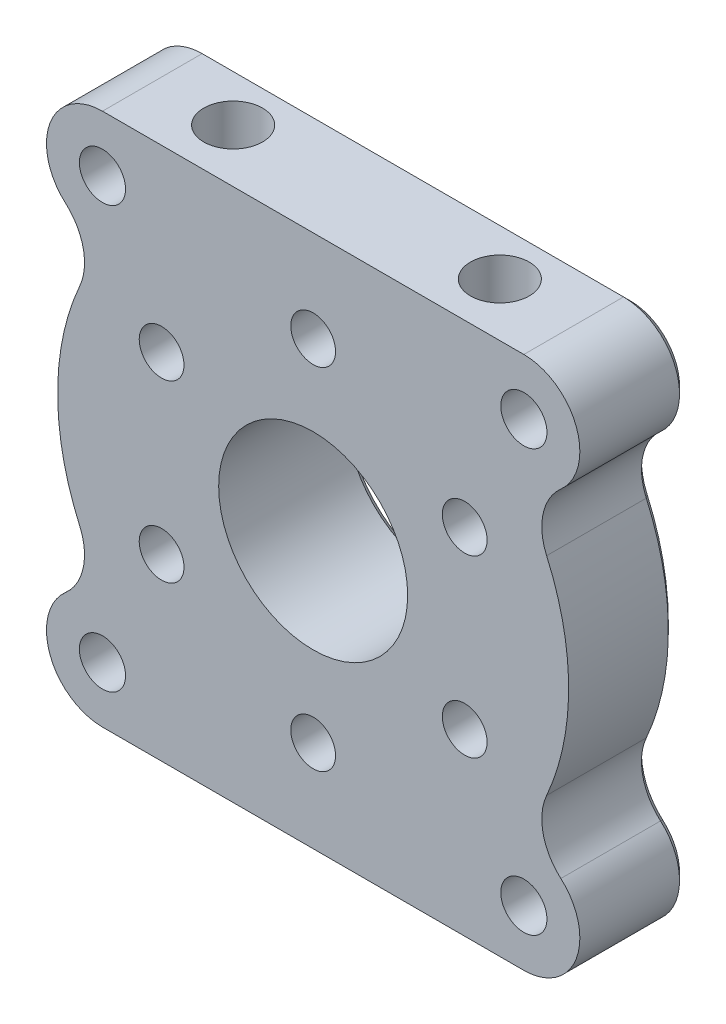
from build123d import *

# Parameters (mm, degrees)
BOSS_EXTRUDE1_DEPTH                                 = 7.62
SKETCH2_R                                           = 6.75
CUT_EXTRUDE1_DEPTH                                  = 28.99766776
SKETCH3_R                                           = 6.75
BOSS_EXTRUDE2_DEPTH                                 = 2
CIRPATTERN1_COUNT                                   = 4
SKETCH8_R                                           = 1.5875
CUT_EXTRUDE2_DEPTH                                  = 2
FILLET3_R                                           = 1.27
M4_TAPPED_HOLE1_D                                   = 3.3
CIRPATTERN3_COUNT                                   = 4
FILLET3_OF_CIRPATTERN3_R                            = 1.27
FILLET2_R                                           = 1.5875
M5_TAPPED_HOLE1_AT_2_COUNT                          = 2
M5_TAPPED_HOLE1_AT_2_PITCH                          = 19.05
CBORE_FOR_M3_HEX_SOCKET_HEAD_CAP_SCREW2_D           = 3.2
CBORE_FOR_M3_HEX_SOCKET_HEAD_CAP_SCREW2_CBORE_D     = 6.5
CBORE_FOR_M3_HEX_SOCKET_HEAD_CAP_SCREW2_CBORE_DEPTH = 5.399996
CIRPATTERN4_COUNT                                   = 6
CUT_EXTRUDE3_DEPTH                                  = 29.606807049
CHAMFER1_SIZE                                       = 0.5


with BuildPart() as part:
    # Sketch1 → Boss-Extrude1 (new body)
    with BuildSketch(Plane.XY):
        with BuildLine():
            Line((-15.0495, -19.05), (15.0495, -19.05))
            ThreePointArc((15.0495, -19.05), (17.878280678, -17.878280678), (19.05, -15.0495))
            Line((19.05, -15.0495), (19.05, 15.0495))
            ThreePointArc((19.05, 15.0495), (17.878280678, 17.878280678), (15.0495, 19.05))
            Line((15.0495, 19.05), (-15.0495, 19.05))
            ThreePointArc((-15.0495, 19.05), (-17.878280678, 17.878280678), (-19.05, 15.0495))
            Line((-19.05, 15.0495), (-19.05, -15.0495))
            ThreePointArc((-19.05, -15.0495), (-17.878280678, -17.878280678), (-15.0495, -19.05))
        make_face()
    extrude(amount=BOSS_EXTRUDE1_DEPTH)

    # Sketch2 → Cut-Extrude1 (cut, through all)
    with BuildSketch(Plane.XY.offset(7.62)):
        Circle(SKETCH2_R)
    extrude(amount=-CUT_EXTRUDE1_DEPTH, mode=Mode.SUBTRACT)

    # Sketch3 → Boss-Extrude2 (add)
    with BuildSketch(Plane(origin=(0, 0, 0), x_dir=(-1, 0, 0), z_dir=(0, 0, -1))):
        with BuildLine():
            Line((8.070331012, 10.191651356), (10.790449481, 12.911769824))
            Line((10.790449481, 12.911769824), (12.911769824, 10.790449481))
            Line((12.911769824, 10.790449481), (10.191651356, 8.070331012))
            ThreePointArc((10.191651356, 8.070331012), (-9.192388155, -9.192388155), (8.070331012, 10.191651356))
        make_face()
        with Locations(Location((0, 0, 0), (0, 0, 180))):
            Circle(SKETCH3_R, mode=Mode.SUBTRACT)
    boss_extrude2 = extrude(amount=BOSS_EXTRUDE2_DEPTH)

    # CirPattern1: Boss-Extrude2 ×4 about axis
    cirpattern1_axis = Axis((0, 0, 0), (0, 0, 1))
    for i in range(1, CIRPATTERN1_COUNT):
        add(boss_extrude2.rotate(cirpattern1_axis, i * 360 / CIRPATTERN1_COUNT))

    # Sketch8 → Cut-Extrude2 (cut)
    with BuildSketch(Plane(origin=(0, 0, -2), x_dir=(-1, 0, 0), z_dir=(0, 0, -1))):
        with Locations((7.486614364, 11.852998738)):
            Circle(SKETCH8_R)
        with Locations((11.852998738, 7.486614364)):
            Circle(SKETCH8_R)
    cut_extrude2 = extrude(amount=-CUT_EXTRUDE2_DEPTH, mode=Mode.SUBTRACT)

    # Fillet3
    fillet3_edges = [part.edges().sort_by_distance(p)[0] for p in [
        (-5.924242574, 11.571661502, -1),
        (-11.571661502, 5.924242574, -1),
    ]]
    fillet(fillet3_edges, radius=FILLET3_R)

    # M4 Tapped Hole1 (through all)
    with Locations(Plane(origin=(0, 0, 0), x_dir=(-1, 0, 0), z_dir=(0, 0, -1))):
        with Locations((15.0495, 15.0495)):
            m4_tapped_hole1 = Hole(M4_TAPPED_HOLE1_D / 2)

    # CirPattern3: Cut-Extrude2, M4 Tapped Hole1 ×4 about axis
    cirpattern3_axis = Axis((0, 0, 0), (0, 0, 1))
    add([cut_extrude2.rotate(cirpattern3_axis, i * 360 / CIRPATTERN3_COUNT) for i in range(1, CIRPATTERN3_COUNT)], mode=Mode.SUBTRACT)
    add([m4_tapped_hole1.rotate(cirpattern3_axis, i * 360 / CIRPATTERN3_COUNT) for i in range(1, CIRPATTERN3_COUNT)], mode=Mode.SUBTRACT)

    # Fillet3 of CirPattern3
    fillet3_of_cirpattern3_edges = [part.edges().sort_by_distance(p)[0] for p in [
        (-11.571661502, -5.924242574, -1),
        (-5.924242574, -11.571661502, -1),
        (5.924242574, -11.571661502, -1),
        (11.571661502, -5.924242574, -1),
        (11.571661502, 5.924242574, -1),
        (5.924242574, 11.571661502, -1),
    ]]
    fillet(fillet3_of_cirpattern3_edges, radius=FILLET3_OF_CIRPATTERN3_R)

    # Fillet2
    # the kernel refuses this fillet: 1.5875 mm, written as the material it adds along each edge
    with BuildSketch(Plane(origin=(-8.070331012, 10.191651356, 1.905), x_dir=(-0.7071067811865533, 0.7071067811865417, 0), z_dir=(0, 0, -1)), Plane(origin=(10.191651356, 8.070331012, 1.905), x_dir=(0.7071067811865428, 0.7071067811865521, 0), z_dir=(0, 0, -1))) as fillet2_piece_1:
        with BuildLine():
            CenterArc((0.762, 1.5875), FILLET2_R, 240.237295365, 29.762704635)
            Line((-0.026049294, 0.209409088), (-0.04181028, 0.18184727))
            ThreePointArc((-0.04181028, 0.18184727), (-0.0441069, 0.100838089), (-0.031537938, -0.003663462))
            Line((-0.031537938, -0.003663462), (0, -0.03175))
            Line((0, -0.03175), (0.762, -0.03175))
            Line((0.762, -0.03175), (0.762, 0))
        make_face()
    extrude(amount=3.905)
    with BuildSketch(Plane(origin=(-10.191651356, 8.070331012, 1.905), x_dir=(-0.614411306606397, -0.7889858974114937, 0), z_dir=(0, 0, -1)), Plane(origin=(8.070331012, 10.191651356, 1.905), x_dir=(-0.788985897411467, 0.6144113066064314, 0), z_dir=(0, 0, -1))) as fillet2_piece_2:
        with BuildLine():
            CenterArc((1.481294819, 0.952137547), FILLET2_R, 187.090842775, 29.762704635)
            Line((-0.094063472, 0.75617198), (-0.125570638, 0.752252669))
            Line((-0.125570638, 0.752252669), (-0.031507166, -0.003919311))
            Line((-0.031507166, -0.003919311), (0.000257692, -0.031748954))
            ThreePointArc((0.000257692, -0.031748954), (0.10551153, -0.031321813), (0.185617625, -0.019042751))
            Line((0.185617625, -0.019042751), (0.21102306, 0))
        make_face()
    extrude(amount=3.905)
    with BuildSketch(Plane(origin=(-10.191651356, -8.070331012, 1.905), x_dir=(-0.6144113066064155, 0.7889858974114793, 0), z_dir=(0, 0, -1)), Plane(origin=(8.070331012, -10.191651356, 1.905), x_dir=(-0.7889858974114808, -0.6144113066064134, 0), z_dir=(0, 0, -1))) as fillet2_piece_3:
        with BuildLine():
            CenterArc((1.481294819, -0.952137547), FILLET2_R, 143.14645259, 29.762704635)
            Line((-0.094063472, -0.75617198), (-0.125570638, -0.752252669))
            Line((-0.125570638, -0.752252669), (-0.031507166, 0.003919311))
            Line((-0.031507166, 0.003919311), (0.000257692, 0.031748954))
            ThreePointArc((0.000257692, 0.031748954), (0.10551153, 0.031321813), (0.185617625, 0.019042751))
            Line((0.185617625, 0.019042751), (0.21102306, 0))
        make_face()
    extrude(amount=3.905)
    with BuildSketch(Plane(origin=(-8.070331012, -10.191651356, 1.905), x_dir=(-0.7071067811865475, -0.7071067811865475, 0), z_dir=(0, 0, -1)), Plane(origin=(10.191651356, -8.070331012, 1.905), x_dir=(0.7071067811865476, -0.7071067811865476, 0), z_dir=(0, 0, -1))) as fillet2_piece_4:
        with BuildLine():
            CenterArc((0.762, -1.5875), FILLET2_R, 90, 29.762704635)
            Line((-0.026049294, -0.209409088), (-0.04181028, -0.18184727))
            ThreePointArc((-0.04181028, -0.18184727), (-0.0441069, -0.100838089), (-0.031537938, 0.003663462))
            Line((-0.031537938, 0.003663462), (0, 0.03175))
            Line((0, 0.03175), (0.762, 0.03175))
            Line((0.762, 0.03175), (0.762, 0))
        make_face()
    extrude(amount=3.905)

    # Sketch11 → M5 Tapped Hole1 (revolve, cut)
    with BuildSketch(Plane(origin=(-9.525, 19.05, 3.81), x_dir=(0, 0, 1), z_dir=(1, 0, 0))):
        Polygon((0, 0), (0, 9.2618167), (2.1, 8.0000094), (2.1, 0), align=None)
    m5_tapped_hole1 = revolve(axis=Axis((-9.525, 25.4, 3.81), (0, -1, 0)), mode=Mode.SUBTRACT)

    # M5 Tapped Hole1 at 2: M5 Tapped Hole1 ×2
    with Locations(*[(i * M5_TAPPED_HOLE1_AT_2_PITCH, 0, 0) for i in range(1, M5_TAPPED_HOLE1_AT_2_COUNT)]):
        add(m5_tapped_hole1, mode=Mode.SUBTRACT)

    # Mirror1: M5 Tapped Hole1 across plane
    add(m5_tapped_hole1.mirror(Plane.ZX), mode=Mode.SUBTRACT)

    # Mirror1 copy 1 sketch → Mirror1 copy 1 (revolve, cut)
    with BuildSketch(Plane(origin=(9.525, -19.05, 3.81), x_dir=(0, 0, 1), z_dir=(1, 0, 0))):
        Polygon((0, 0), (0, -9.2618167), (2.1, -8.0000094), (2.1, 0), align=None)
    revolve(axis=Axis((9.525, -25.4, 3.81), (0, -1, 0)), mode=Mode.SUBTRACT)

    # CBORE for M3 Hex Socket Head Cap Screw2 (through all)
    with Locations(Plane(origin=(0, 0, -2), x_dir=(-1, 0, 0), z_dir=(0, 0, -1))):
        with Locations((0, 12.5)):
            cbore_for_m3_hex_socket_head_cap_screw2 = CounterBoreHole(CBORE_FOR_M3_HEX_SOCKET_HEAD_CAP_SCREW2_D / 2, CBORE_FOR_M3_HEX_SOCKET_HEAD_CAP_SCREW2_CBORE_D / 2, CBORE_FOR_M3_HEX_SOCKET_HEAD_CAP_SCREW2_CBORE_DEPTH)

    # CirPattern4: CBORE for M3 Hex Socket Head Cap Screw2 ×6 about axis
    cirpattern4_axis = Axis((0, 0, 0), (0, 0, 1))
    for i in range(1, CIRPATTERN4_COUNT):
        add(cbore_for_m3_hex_socket_head_cap_screw2.rotate(cirpattern4_axis, i * 360 / CIRPATTERN4_COUNT), mode=Mode.SUBTRACT)

    # Sketch19 → Cut-Extrude3 (cut, through all)
    with BuildSketch(Plane.XY.offset(7.62)):
        with BuildLine():
            Line((19.05, -15.0495), (19.05, 15.0495))
            ThreePointArc((19.05, 15.0495), (18.694305158, 13.400440992), (17.690472135, 12.04462622))
            ThreePointArc((17.690472135, 12.04462622), (16.423645851, 9.895971906), (16.675978424, 7.414461789))
            ThreePointArc((16.675978424, 7.414461789), (18.25, 0), (16.675978424, -7.414461789))
            ThreePointArc((16.675978424, -7.414461789), (16.423645851, -9.895971906), (17.690472135, -12.04462622))
            ThreePointArc((17.690472135, -12.04462622), (18.694305158, -13.400440992), (19.05, -15.0495))
        make_face()
    cut_extrude3 = extrude(amount=-CUT_EXTRUDE3_DEPTH, mode=Mode.SUBTRACT)

    # Mirror2: Cut-Extrude3 across plane
    add(cut_extrude3.mirror(Plane(origin=(0, 0, 0), x_dir=(0, 0, 1), z_dir=(1, 0, 0))), mode=Mode.SUBTRACT)

    # Chamfer1
    # the kernel refuses this chamfer: 0.5 mm, written as the material it takes off along each edge
    with BuildSketch(Plane(origin=(15.0495, -15.0495, 0), x_dir=(0.6601605135971749, 0.751124554442946, 0), z_dir=(-0.751124554442946, 0.6601605135971749, 0))) as chamfer1_piece_1:
        Polygon((4.0005 - CHAMFER1_SIZE, 0), (4.0005, -CHAMFER1_SIZE), (4.0005, 0), align=None)
    revolve(axis=Axis((15.0495, -15.0495, 0), (0, 0, -1)), revolution_arc=138.687884381, mode=Mode.SUBTRACT)
    with BuildSketch(Plane(origin=(-15.0495, -19.05, 0), x_dir=(0, 1, 0), z_dir=(1, 0, 0)), Plane(origin=(15.0495, 19.05, 0), x_dir=(0, -1, 0), z_dir=(-1, 0, 0))) as chamfer1_piece_2:
        Polygon((CHAMFER1_SIZE, 0), (0, CHAMFER1_SIZE), (0, 0), align=None)
    extrude(amount=30.099, mode=Mode.SUBTRACT)
    with BuildSketch(Plane(origin=(-15.0495, -15.0495, 0), x_dir=(-1, 0, 0), z_dir=(0, 1, 0))) as chamfer1_piece_3:
        Polygon((4.0005 - CHAMFER1_SIZE, 0), (4.0005, CHAMFER1_SIZE), (4.0005, 0), align=None)
    revolve(axis=Axis((-15.0495, -15.0495, 0), (0, 0, 1)), revolution_arc=90, mode=Mode.SUBTRACT)
    with BuildSketch(Plane(origin=(0, 0, -2), x_dir=(-0.1530711166814941, 0.988215175575583, 0), z_dir=(0.988215175575583, 0.1530711166814941, 0))) as chamfer1_piece_4:
        Polygon((13 - CHAMFER1_SIZE, 0), (13, CHAMFER1_SIZE), (13, 0), align=None)
    revolve(axis=Axis((0, 0, -2), (0, 0, 1)), revolution_arc=15.826641265, mode=Mode.SUBTRACT)
    with BuildSketch(Plane(origin=(-7.486614364, 11.852998738, -2), x_dir=(0.9091030209612923, -0.4165713591679727, 0), z_dir=(0.4165713591679727, 0.9091030209612923, 0))) as chamfer1_piece_5:
        Polygon((1.5875 + CHAMFER1_SIZE, 0), (1.5875, -CHAMFER1_SIZE), (1.5875, 0), align=None)
    revolve(axis=Axis((-7.486614364, 11.852998738, -2), (0, 0, -1)), revolution_arc=80.618983866, mode=Mode.SUBTRACT)
    with BuildSketch(Plane(origin=(-4.888852475, 10.662646073, -2), x_dir=(-0.41678197004398493, 0.9090064848207933, 0), z_dir=(0.9090064848207933, 0.41678197004398493, 0))) as chamfer1_piece_6:
        Polygon((1.270000009 - CHAMFER1_SIZE, 0), (1.270000009 + CHAMFER1_SIZE * 1.146713835e-09, CHAMFER1_SIZE), (1.270000009, 0), align=None)
    revolve(axis=Axis((-4.888852475, 10.662646073, -2), (0, 0, 1)), revolution_arc=40.750102505, mode=Mode.SUBTRACT)
    with BuildSketch(Plane(origin=(-7.486614364, -11.852998738, -2), x_dir=(-0.26281727826186874, 0.964845624049269, 0), z_dir=(-0.964845624049269, -0.26281727826186874, 0))) as chamfer1_piece_7:
        Polygon((1.5875 + CHAMFER1_SIZE, 0), (1.5875, -CHAMFER1_SIZE), (1.5875, 0), align=None)
    revolve(axis=Axis((-7.486614364, -11.852998738, -2), (0, 0, -1)), revolution_arc=80.618983866, mode=Mode.SUBTRACT)
    with BuildSketch(Plane(origin=(7.486614364, 11.852998738, -2), x_dir=(0.26281727826191403, -0.9648456240492567, 0), z_dir=(0.9648456240492567, 0.26281727826191403, 0))) as chamfer1_piece_8:
        Polygon((1.5875 + CHAMFER1_SIZE, 0), (1.5875, -CHAMFER1_SIZE), (1.5875, 0), align=None)
    revolve(axis=Axis((7.486614364, 11.852998738, -2), (0, 0, -1)), revolution_arc=80.618983866, mode=Mode.SUBTRACT)
    with BuildSketch(Plane(origin=(-4.888852475, -10.662646073, -2), x_dir=(-0.9091030199147513, -0.4165713614518878, 0), z_dir=(-0.4165713614518878, 0.9091030199147513, 0))) as chamfer1_piece_9:
        Polygon((1.270000009 - CHAMFER1_SIZE, 0), (1.270000009 + CHAMFER1_SIZE * 1.14671028228e-09, CHAMFER1_SIZE), (1.270000009, 0), align=None)
    revolve(axis=Axis((-4.888852475, -10.662646073, -2), (0, 0, 1)), revolution_arc=40.750102505, mode=Mode.SUBTRACT)
    with BuildSketch(Plane(origin=(0, 0, -2), x_dir=(0.1530711166814983, -0.9882151755755824, 0), z_dir=(-0.9882151755755824, -0.1530711166814983, 0))) as chamfer1_piece_10:
        Polygon((13 - CHAMFER1_SIZE, 0), (13, CHAMFER1_SIZE), (13, 0), align=None)
    revolve(axis=Axis((0, 0, -2), (0, 0, 1)), revolution_arc=15.826641265, mode=Mode.SUBTRACT)
    with BuildSketch(Plane(origin=(7.486614364, -11.852998738, -2), x_dir=(-0.9091030209612878, 0.41657135916798255, 0), z_dir=(-0.41657135916798255, -0.9091030209612878, 0))) as chamfer1_piece_11:
        Polygon((1.5875 + CHAMFER1_SIZE, 0), (1.5875, -CHAMFER1_SIZE), (1.5875, 0), align=None)
    revolve(axis=Axis((7.486614364, -11.852998738, -2), (0, 0, -1)), revolution_arc=80.618983866, mode=Mode.SUBTRACT)
    with BuildSketch(Plane(origin=(4.888852475, -10.662646073, -2), x_dir=(0.41678197004398276, -0.9090064848207942, 0), z_dir=(-0.9090064848207942, -0.41678197004398276, 0))) as chamfer1_piece_12:
        Polygon((1.270000009 - CHAMFER1_SIZE, 0), (1.270000009 + CHAMFER1_SIZE * 1.14671694362e-09, CHAMFER1_SIZE), (1.270000009, 0), align=None)
    revolve(axis=Axis((4.888852475, -10.662646073, -2), (0, 0, 1)), revolution_arc=40.750102505, mode=Mode.SUBTRACT)
    with BuildSketch(Plane(origin=(4.888852475, 10.662646073, -2), x_dir=(0.9091030199147588, 0.41657136145187135, 0), z_dir=(0.41657136145187135, -0.9091030199147588, 0))) as chamfer1_piece_13:
        Polygon((1.270000009 - CHAMFER1_SIZE, 0), (1.270000009 + CHAMFER1_SIZE * 1.14671117046e-09, CHAMFER1_SIZE), (1.270000009, 0), align=None)
    revolve(axis=Axis((4.888852475, 10.662646073, -2), (0, 0, 1)), revolution_arc=40.750102505, mode=Mode.SUBTRACT)
    with BuildSketch(Plane(origin=(-9.881222241, 13.820997064, -2), x_dir=(0.7071067811865476, -0.7071067811865476, 0), z_dir=(-0.7071067811865476, -0.7071067811865476, 0)), Plane(origin=(13.820997064, 9.881222241, -2), x_dir=(-0.7071067811865477, -0.7071067811865475, 0), z_dir=(-0.7071067811865475, 0.7071067811865477, 0)), Plane(origin=(9.881222241, -13.820997064, -2), x_dir=(-0.7071067811865475, 0.7071067811865477, 0), z_dir=(0.7071067811865477, 0.7071067811865475, 0)), Plane(origin=(-13.820997064, -9.881222241, -2), x_dir=(0.7071067811865477, 0.7071067811865475, 0), z_dir=(0.7071067811865475, -0.7071067811865477, 0))) as chamfer1_piece_14:
        Polygon((CHAMFER1_SIZE, 0), (0, CHAMFER1_SIZE), (0, 0), align=None)
    extrude(amount=5.571682988, mode=Mode.SUBTRACT)
    with BuildSketch(Plane(origin=(-8.609146379, 10.730466723, -2), x_dir=(-0.7071067811865461, -0.707106781186549, 0), z_dir=(-0.7071067811865489, 0.7071067811865461, 0))) as chamfer1_piece_15:
        Polygon((CHAMFER1_SIZE, 0), (0, CHAMFER1_SIZE), (0, 0), align=None)
    extrude(amount=4.370669924, mode=Mode.SUBTRACT)
    with BuildSketch(Plane(origin=(-8.609146379, -10.730466723, -2), x_dir=(-0.7071067811865471, 0.707106781186548, 0), z_dir=(-0.707106781186548, -0.7071067811865471, 0)), Plane(origin=(8.609146379, 10.730466723, -2), x_dir=(0.7071067811865469, -0.7071067811865482, 0), z_dir=(0.7071067811865482, 0.7071067811865468, 0)), Plane(origin=(11.699676721, -13.820997064, -2), x_dir=(0.7071067811865461, 0.707106781186549, 0), z_dir=(-0.7071067811865489, 0.7071067811865461, 0))) as chamfer1_piece_16:
        Polygon((CHAMFER1_SIZE, 0), (0, -CHAMFER1_SIZE), (0, 0), align=None)
    extrude(amount=4.370669924, mode=Mode.SUBTRACT)
    with BuildSketch(Plane(origin=(-7.486614364, -11.852998738, -2), x_dir=(-0.707106781186547, 0.7071067811865481, 0), z_dir=(-0.7071067811865481, -0.707106781186547, 0))) as chamfer1_piece_17:
        Polygon((1.5875 + CHAMFER1_SIZE, 0), (1.5875, -CHAMFER1_SIZE), (1.5875, 0), align=None)
    revolve(axis=Axis((-7.486614364, -11.852998738, -2), (0, 0, -1)), revolution_arc=29.762704635, mode=Mode.SUBTRACT)
    with BuildSketch(Plane(origin=(7.486614364, -11.852998738, -2), x_dir=(0.2628172782594346, 0.9648456240499321, 0), z_dir=(-0.9648456240499321, 0.2628172782594346, 0))) as chamfer1_piece_18:
        Polygon((1.5875 + CHAMFER1_SIZE, 0), (1.5875, -CHAMFER1_SIZE), (1.5875, 0), align=None)
    revolve(axis=Axis((7.486614364, -11.852998738, -2), (0, 0, -1)), revolution_arc=29.762704635, mode=Mode.SUBTRACT)
    with BuildSketch(Plane(origin=(7.486614364, 11.852998738, -2), x_dir=(0.7071067811865567, -0.7071067811865382, 0), z_dir=(0.7071067811865382, 0.7071067811865567, 0))) as chamfer1_piece_19:
        Polygon((1.5875 + CHAMFER1_SIZE, 0), (1.5875, -CHAMFER1_SIZE), (1.5875, 0), align=None)
    revolve(axis=Axis((7.486614364, 11.852998738, -2), (0, 0, -1)), revolution_arc=29.762704635, mode=Mode.SUBTRACT)
    with BuildSketch(Plane(origin=(-7.486614364, 11.852998738, -2), x_dir=(-0.2628172782594555, -0.9648456240499265, 0), z_dir=(0.9648456240499265, -0.2628172782594555, 0))) as chamfer1_piece_20:
        Polygon((1.5875 + CHAMFER1_SIZE, 0), (1.5875, -CHAMFER1_SIZE), (1.5875, 0), align=None)
    revolve(axis=Axis((-7.486614364, 11.852998738, -2), (0, 0, -1)), revolution_arc=29.762704635, mode=Mode.SUBTRACT)
    with BuildSketch(Plane(origin=(0, 0, -2), x_dir=(1, 0, 0), z_dir=(0, -1, 0))) as chamfer1_piece_21:
        Polygon((6.75 + CHAMFER1_SIZE, 0), (6.75, CHAMFER1_SIZE), (6.75, 0), align=None)
    revolve(axis=Axis((0, 0, -2), (0, 0, 1)), mode=Mode.SUBTRACT)
    with BuildSketch(Plane(origin=(0, 0, -2), x_dir=(0.41678196776032433, 0.9090064858678577, 0), z_dir=(0.9090064858678577, -0.41678196776032433, 0))) as chamfer1_piece_22:
        Polygon((13 - CHAMFER1_SIZE, 0), (13, CHAMFER1_SIZE), (13, 0), align=None)
    revolve(axis=Axis((0, 0, -2), (0, 0, 1)), revolution_arc=15.826641265, mode=Mode.SUBTRACT)
    with BuildSketch(Plane(origin=(0, 12.5, -2), x_dir=(0.9117724101369729, 0.4106958389282947, 0), z_dir=(-0.4106958389282947, 0.9117724101369729, 0))) as chamfer1_piece_23:
        Polygon((3.25 + CHAMFER1_SIZE, 0), (3.25, -CHAMFER1_SIZE), (3.25, 0), align=None)
    revolve(axis=Axis((0, 12.5, -2), (0, 0, -1)), revolution_arc=226.954342527, mode=Mode.SUBTRACT)
    with BuildSketch(Plane(origin=(0, 0, -2), x_dir=(0.9323534777462221, -0.3615480501047196, 0), z_dir=(-0.3615480501047196, -0.9323534777462221, 0))) as chamfer1_piece_24:
        Polygon((13 - CHAMFER1_SIZE, 0), (13, CHAMFER1_SIZE), (13, 0), align=None)
    revolve(axis=Axis((0, 0, -2), (0, 0, 1)), revolution_arc=42.390595109, mode=Mode.SUBTRACT)
    with BuildSketch(Plane(origin=(10.825317547, 6.25, -2), x_dir=(0.8115592348089499, -0.584270150184238, 0), z_dir=(0.584270150184238, 0.8115592348089499, 0))) as chamfer1_piece_25:
        Polygon((3.25 + CHAMFER1_SIZE, 0), (3.25, -CHAMFER1_SIZE), (3.25, 0), align=None)
    revolve(axis=Axis((10.825317547, 6.25, -2), (0, 0, -1)), revolution_arc=204.248553812, mode=Mode.SUBTRACT)
    with BuildSketch(Plane(origin=(10.632214046, -8.510893703, -2), x_dir=(-0.707106781186548, -0.7071067811865471, 0), z_dir=(0.7071067811865471, -0.707106781186548, 0)), Plane(origin=(13.820997064, 11.699676721, -2), x_dir=(-0.7071067811865488, 0.7071067811865464, 0), z_dir=(-0.7071067811865464, -0.7071067811865487, 0)), Plane(origin=(-13.820997064, -11.699676721, -2), x_dir=(0.7071067811865489, -0.7071067811865462, 0), z_dir=(0.7071067811865461, 0.7071067811865489, 0))) as chamfer1_piece_26:
        Polygon((CHAMFER1_SIZE, 0), (0, -CHAMFER1_SIZE), (0, 0), align=None)
    extrude(amount=4.509620192, mode=Mode.SUBTRACT)
    with BuildSketch(Plane(origin=(10.825317547, -6.25, -2), x_dir=(0.5800477108413182, -0.8145825023579542, 0), z_dir=(0.8145825023579542, 0.5800477108413182, 0))) as chamfer1_piece_27:
        Polygon((3.25 + CHAMFER1_SIZE, 0), (3.25, -CHAMFER1_SIZE), (3.25, 0), align=None)
    revolve(axis=Axis((10.825317547, -6.25, -2), (0, 0, -1)), revolution_arc=268.178454583, mode=Mode.SUBTRACT)
    with BuildSketch(Plane(origin=(0, 0, -2), x_dir=(-0.4167819677603308, -0.9090064858678548, 0), z_dir=(-0.9090064858678548, 0.4167819677603308, 0))) as chamfer1_piece_28:
        Polygon((13 - CHAMFER1_SIZE, 0), (13, CHAMFER1_SIZE), (13, 0), align=None)
    revolve(axis=Axis((0, 0, -2), (0, 0, 1)), revolution_arc=15.826641265, mode=Mode.SUBTRACT)
    with BuildSketch(Plane(origin=(0, -12.5, -2), x_dir=(-0.9117724101369725, -0.41069583892829525, 0), z_dir=(0.41069583892829525, -0.9117724101369725, 0))) as chamfer1_piece_29:
        Polygon((3.25 + CHAMFER1_SIZE, 0), (3.25, -CHAMFER1_SIZE), (3.25, 0), align=None)
    revolve(axis=Axis((0, -12.5, -2), (0, 0, -1)), revolution_arc=226.954342527, mode=Mode.SUBTRACT)
    with BuildSketch(Plane(origin=(0, 0, -2), x_dir=(-0.9323534777462222, 0.3615480501047193, 0), z_dir=(0.3615480501047193, 0.9323534777462222, 0))) as chamfer1_piece_30:
        Polygon((13 - CHAMFER1_SIZE, 0), (13, CHAMFER1_SIZE), (13, 0), align=None)
    revolve(axis=Axis((0, 0, -2), (0, 0, 1)), revolution_arc=42.390595109, mode=Mode.SUBTRACT)
    with BuildSketch(Plane(origin=(-10.825317547, -6.25, -2), x_dir=(-0.8115592348089544, 0.5842701501842315, 0), z_dir=(-0.5842701501842315, -0.8115592348089544, 0))) as chamfer1_piece_31:
        Polygon((3.25 + CHAMFER1_SIZE, 0), (3.25, -CHAMFER1_SIZE), (3.25, 0), align=None)
    revolve(axis=Axis((-10.825317547, -6.25, -2), (0, 0, -1)), revolution_arc=204.248553812, mode=Mode.SUBTRACT)
    with BuildSketch(Plane(origin=(-13.820997064, 11.699676721, -2), x_dir=(0.707106781186548, 0.7071067811865471, 0), z_dir=(0.7071067811865471, -0.707106781186548, 0))) as chamfer1_piece_32:
        Polygon((CHAMFER1_SIZE, 0), (0, CHAMFER1_SIZE), (0, 0), align=None)
    extrude(amount=4.509620192, mode=Mode.SUBTRACT)
    with BuildSketch(Plane(origin=(-10.825317547, 6.25, -2), x_dir=(-0.5800477108413269, 0.8145825023579479, 0), z_dir=(-0.8145825023579479, -0.5800477108413269, 0))) as chamfer1_piece_33:
        Polygon((3.25 + CHAMFER1_SIZE, 0), (3.25, -CHAMFER1_SIZE), (3.25, 0), align=None)
    revolve(axis=Axis((-10.825317547, 6.25, -2), (0, 0, -1)), revolution_arc=268.178454583, mode=Mode.SUBTRACT)
    with BuildSketch(Plane(origin=(20.331444269, -9.03975244, 0), x_dir=(-0.9137522423896537, 0.4062718788297801, 0), z_dir=(0.4062718788297801, 0.9137522423896537, 0))) as chamfer1_piece_34:
        Polygon((4.0005 + CHAMFER1_SIZE, 0), (4.0005, CHAMFER1_SIZE), (4.0005, 0), align=None)
    revolve(axis=Axis((20.331444269, -9.03975244, 0), (0, 0, 1)), revolution_arc=72.658738578, mode=Mode.SUBTRACT)
    with BuildSketch(Plane(origin=(0, 0, 0), x_dir=(0.9137522423896537, -0.40627187882977994, 0), z_dir=(-0.40627187882977994, -0.9137522423896537, 0))) as chamfer1_piece_35:
        Polygon((18.25 - CHAMFER1_SIZE, 0), (18.25, CHAMFER1_SIZE), (18.25, 0), align=None)
    revolve(axis=Axis((0, 0, 0), (0, 0, 1)), revolution_arc=47.941708394, mode=Mode.SUBTRACT)
    with BuildSketch(Plane(origin=(20.331444269, 9.03975244, 0), x_dir=(-0.6601605135971895, 0.7511245544429334, 0), z_dir=(0.7511245544429334, 0.6601605135971895, 0))) as chamfer1_piece_36:
        Polygon((4.0005 + CHAMFER1_SIZE, 0), (4.0005, CHAMFER1_SIZE), (4.0005, 0), align=None)
    revolve(axis=Axis((20.331444269, 9.03975244, 0), (0, 0, 1)), revolution_arc=72.658738578, mode=Mode.SUBTRACT)
    with BuildSketch(Plane(origin=(-20.331444269, 9.03975244, 0), x_dir=(0.9137522423896556, -0.4062718788297762, 0), z_dir=(-0.4062718788297762, -0.9137522423896556, 0))) as chamfer1_piece_37:
        Polygon((4.0005 + CHAMFER1_SIZE, 0), (4.0005, CHAMFER1_SIZE), (4.0005, 0), align=None)
    revolve(axis=Axis((-20.331444269, 9.03975244, 0), (0, 0, 1)), revolution_arc=72.658738578, mode=Mode.SUBTRACT)
    with BuildSketch(Plane(origin=(0, 0, 0), x_dir=(-0.9137522423896547, 0.4062718788297779, 0), z_dir=(0.4062718788297779, 0.9137522423896547, 0))) as chamfer1_piece_38:
        Polygon((18.25 - CHAMFER1_SIZE, 0), (18.25, CHAMFER1_SIZE), (18.25, 0), align=None)
    revolve(axis=Axis((0, 0, 0), (0, 0, 1)), revolution_arc=47.941708394, mode=Mode.SUBTRACT)
    with BuildSketch(Plane(origin=(-20.331444269, -9.03975244, 0), x_dir=(0.6601605135971734, -0.7511245544429475, 0), z_dir=(-0.7511245544429475, -0.6601605135971734, 0))) as chamfer1_piece_39:
        Polygon((4.0005 + CHAMFER1_SIZE, 0), (4.0005, CHAMFER1_SIZE), (4.0005, 0), align=None)
    revolve(axis=Axis((-20.331444269, -9.03975244, 0), (0, 0, 1)), revolution_arc=72.658738578, mode=Mode.SUBTRACT)
    with BuildSketch(Plane(origin=(-15.0495, 15.0495, 0), x_dir=(0, 1, 0), z_dir=(1, 0, 0))) as chamfer1_piece_40:
        Polygon((4.0005 - CHAMFER1_SIZE, 0), (4.0005, CHAMFER1_SIZE), (4.0005, 0), align=None)
    revolve(axis=Axis((-15.0495, 15.0495, 0), (0, 0, 1)), revolution_arc=90, mode=Mode.SUBTRACT)
    with BuildSketch(Plane(origin=(15.0495, 15.0495, 0), x_dir=(0, 1, 0), z_dir=(-1, 0, 0))) as chamfer1_piece_41:
        Polygon((4.0005 - CHAMFER1_SIZE, 0), (4.0005, -CHAMFER1_SIZE), (4.0005, 0), align=None)
    revolve(axis=Axis((15.0495, 15.0495, 0), (0, 0, -1)), revolution_arc=138.687884381, mode=Mode.SUBTRACT)
    with BuildSketch(Plane(origin=(-15.0495, 15.0495, 0), x_dir=(-1, 0, 0), z_dir=(0, 1, 0))) as chamfer1_piece_42:
        Polygon((4.0005 - CHAMFER1_SIZE, 0), (4.0005, CHAMFER1_SIZE), (4.0005, 0), align=None)
    revolve(axis=Axis((-15.0495, 15.0495, 0), (0, 0, 1)), revolution_arc=48.687884381, mode=Mode.SUBTRACT)
    with BuildSketch(Plane(origin=(-15.0495, -15.0495, 0), x_dir=(-0.6601605135971749, 0.751124554442946, 0), z_dir=(0.751124554442946, 0.6601605135971749, 0))) as chamfer1_piece_43:
        Polygon((4.0005 - CHAMFER1_SIZE, 0), (4.0005, CHAMFER1_SIZE), (4.0005, 0), align=None)
    revolve(axis=Axis((-15.0495, -15.0495, 0), (0, 0, 1)), revolution_arc=48.687884381, mode=Mode.SUBTRACT)
    with BuildSketch(Plane(origin=(-10.825317547, -6.25, -2), x_dir=(0.49999999999999994, -0.8660254037844387, 0), z_dir=(0.8660254037844387, 0.49999999999999994, 0))) as chamfer1_piece_44:
        Polygon((3.25 + CHAMFER1_SIZE, 0), (3.25, -CHAMFER1_SIZE), (3.25, 0), align=None)
    revolve(axis=Axis((-10.825317547, -6.25, -2), (0, 0, -1)), revolution_arc=65.400099282, mode=Mode.SUBTRACT)
    with BuildSketch(Plane(origin=(10.825317547, 6.25, -2), x_dir=(-0.5000000000000001, 0.8660254037844386, 0), z_dir=(-0.8660254037844386, -0.5000000000000001, 0))) as chamfer1_piece_45:
        Polygon((3.25 + CHAMFER1_SIZE, 0), (3.25, -CHAMFER1_SIZE), (3.25, 0), align=None)
    revolve(axis=Axis((10.825317547, 6.25, -2), (0, 0, -1)), revolution_arc=65.400099282, mode=Mode.SUBTRACT)


solid = part.part
